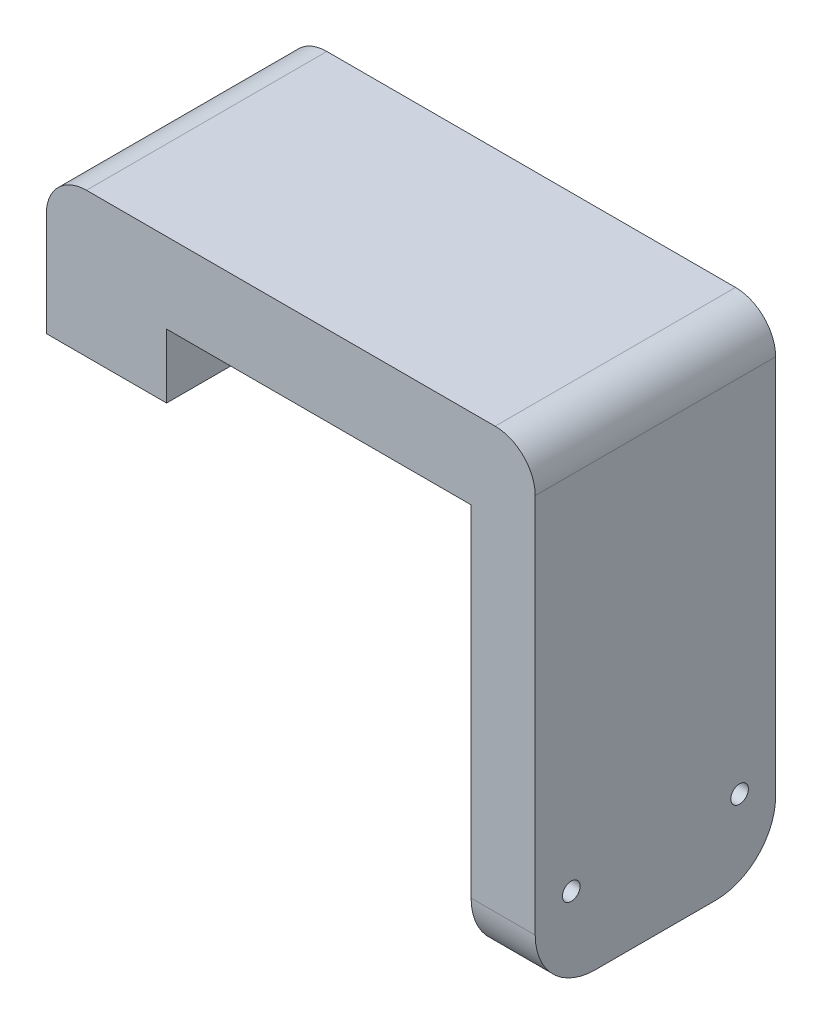
from build123d import *

# Parameters (mm, degrees)
EXTRUDE_1_DEPTH     = 30
SKETCH_2_R          = 1.1
CUT_EXTRUDE_1_DEPTH = 74.979726953
FILLET_1_R          = 7.5


with BuildPart() as part:
    # ｽｹｯﾁ1 → ﾎﾞｽ - 押し出し1 (new body)
    with BuildSketch(Plane.XY):
        with BuildLine():
            Line((-15, 0), (0, 0))
            Line((0, 0), (0, 8))
            Line((0, 8), (38, 8))
            Line((38, 8), (38, -42))
            Line((38, -42), (46, -42))
            Line((46, -42), (46, 13))
            ThreePointArc((46, 13), (44.535533906, 16.535533906), (41, 18))
            Line((41, 18), (-10, 18))
            ThreePointArc((-10, 18), (-13.535533906, 16.535533906), (-15, 13))
            Line((-15, 13), (-15, 0))
        make_face()
    extrude(amount=EXTRUDE_1_DEPTH)

    # ｽｹｯﾁ2 → ｶｯﾄ - 押し出し1 (cut, through all)
    with BuildSketch(Plane.ZY.offset(-38)):
        with Locations((4.5, -32)):
            Circle(SKETCH_2_R)
        with Locations((25.5, -32)):
            Circle(SKETCH_2_R)
    extrude(amount=-CUT_EXTRUDE_1_DEPTH, mode=Mode.SUBTRACT)

    # ﾌｨﾚｯﾄ1
    fillet_1_edges = [part.edges().sort_by_distance(p)[0] for p in [
        (42, -42, 30),
        (42, -42, 0),
    ]]
    fillet(fillet_1_edges, radius=FILLET_1_R)


solid = part.part
